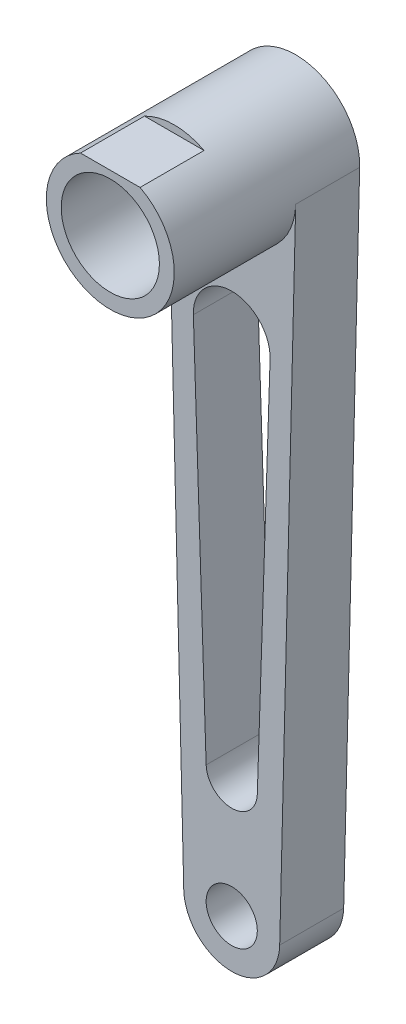
from build123d import *

# Parameters (mm, degrees)
SKETCH1_R           = 4
BOSS_EXTRUDE2_DEPTH = 10
SKETCH1_6_R         = 7.675
BOSS_EXTRUDE3_DEPTH = 28.98
SKETCH2_W           = 20.025396677
SKETCH2_H           = 9.808205023
CUT_EXTRUDE1_DEPTH  = 10


with BuildPart() as part:
    # Sketch1 → Boss-Extrude2 (new body)
    with BuildSketch(Plane.XY):
        with BuildLine():
            ThreePointArc((9.996972197, -0.246062766), (5.5e-08, -10), (-9.996972195, -0.246062876))
            Line((-9.996972195, -0.246062876), (-7.497729139, -101.784547426))
            ThreePointArc((-7.497729139, -101.784547426), (1.58e-07, -109.1), (7.497729147, -101.784547111))
            Line((7.497729147, -101.784547111), (9.996972197, -0.246062766))
        make_face()
        with BuildLine():
            Line((5.996665744, -23.199999888), (3.997777167, -83.133333141))
            ThreePointArc((3.997777167, -83.133333141), (1.93e-07, -87), (-3.997777154, -83.133333527))
            Line((-3.997777154, -83.133333527), (-5.996665745, -23.199999845))
            ThreePointArc((-5.996665745, -23.199999845), (2.1e-08, -17), (5.996665744, -23.199999888))
        make_face(mode=Mode.SUBTRACT)
        with Locations((0, -101.6)):
            Circle(SKETCH1_R, mode=Mode.SUBTRACT)
    extrude(amount=BOSS_EXTRUDE2_DEPTH)

    # Sketch1<6> → Boss-Extrude3 (add)
    with BuildSketch(Plane.XY):
        with BuildLine():
            ThreePointArc((10, 0), (-0.123040752, 9.99924302), (-9.996972195, -0.246062876))
            ThreePointArc((-9.996972195, -0.246062876), (5.5e-08, -10), (9.996972197, -0.246062766))
            ThreePointArc((9.996972197, -0.246062766), (9.999243021, -0.123040697), (10, 0))
        make_face()
        Circle(SKETCH1_6_R, mode=Mode.SUBTRACT)
    extrude(amount=BOSS_EXTRUDE3_DEPTH)

    # Sketch2 → Cut-Extrude1 (cut)
    with BuildSketch(Plane.XY.offset(28.98)):
        with Locations((-0.020605473, 13.754102512)):
            Rectangle(SKETCH2_W, SKETCH2_H)
    extrude(amount=-CUT_EXTRUDE1_DEPTH, mode=Mode.SUBTRACT)


solid = part.part
